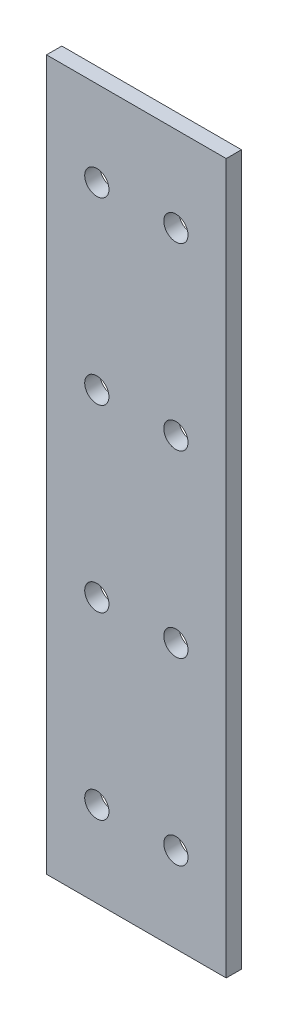
from build123d import *

# Parameters (mm, degrees)
SKETCH1_W           = 20
SKETCH1_H           = 79
BOSS_EXTRUDE1_DEPTH = 1.7
SKETCH3_R           = 1.35
CUT_EXTRUDE1_DEPTH  = 41.781613504


with BuildPart() as part:
    # Sketch1 → Boss-Extrude1 (new body)
    with BuildSketch(Plane.XY):
        Rectangle(SKETCH1_W, SKETCH1_H)
    extrude(amount=BOSS_EXTRUDE1_DEPTH)

    # Sketch3 → Cut-Extrude1 (cut, through all)
    with BuildSketch(Plane.XY.offset(1.7)):
        with Locations((-4.4, 30)):
            Circle(SKETCH3_R)
        with Locations((-4.4, 10)):
            Circle(SKETCH3_R)
        with Locations((-4.4, -10)):
            Circle(SKETCH3_R)
        with Locations((-4.4, -30)):
            Circle(SKETCH3_R)
        with Locations((4.4, -30)):
            Circle(SKETCH3_R)
        with Locations((4.4, -10)):
            Circle(SKETCH3_R)
        with Locations((4.4, 10)):
            Circle(SKETCH3_R)
        with Locations((4.4, 30)):
            Circle(SKETCH3_R)
    extrude(amount=-CUT_EXTRUDE1_DEPTH, mode=Mode.SUBTRACT)


solid = part.part
